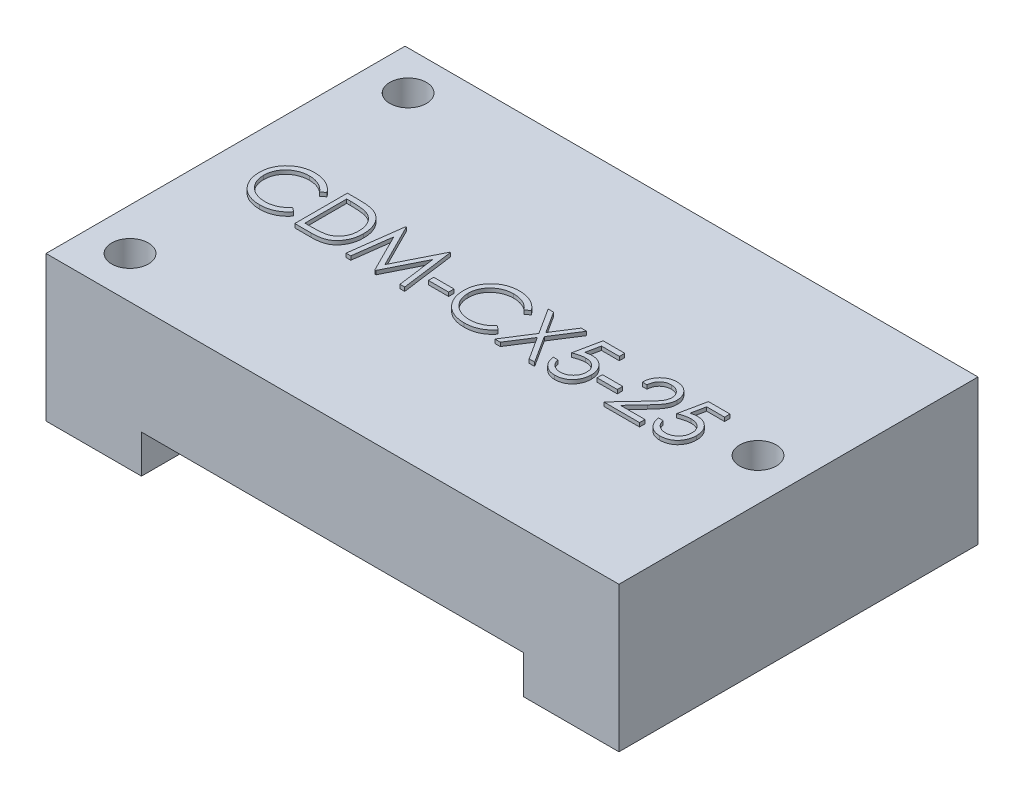
from build123d import *

# Parameters (mm, degrees)
SKETCH1_W               = 38.1
SKETCH1_H               = 23.876
SKETCH1_R               = 1.2192
BOSS_EXTRUDE1_DEPTH     = 9.652
SKETCH2_W               = 1.346153846
SKETCH2_H               = 0.358974359
BOSS_EXTRUDE2_DEPTH     = 0.254
CUT_EXTRUDE1_DEPTH      = 25.465883475
CUT_EXTRUDE1_DEPTH_BACK = 25.465883475
SKETCH4_W               = 25.4
SKETCH4_H               = 2.54


with BuildPart() as part:
    # Sketch1 → Boss-Extrude1 (new body)
    with BuildSketch(Plane(origin=(0, 0, 0), x_dir=(1, 0, 0), z_dir=(0, 1, 0))):
        Rectangle(SKETCH1_W, SKETCH1_H)
        with Locations((-16.256, 9.3472)):
            Circle(SKETCH1_R, mode=Mode.SUBTRACT)
        with Locations((-16.256, -9.144)):
            Circle(SKETCH1_R, mode=Mode.SUBTRACT)
        with Locations((16.256, 0.1016)):
            Circle(SKETCH1_R, mode=Mode.SUBTRACT)
    extrude(amount=-BOSS_EXTRUDE1_DEPTH)

    # Sketch2 → Boss-Extrude2 (add)
    # profile 1 of 10: a face of its own
    with BuildSketch(Plane(origin=(0, 0, 0), x_dir=(1, 0, 0), z_dir=(0, 1, 0))):
        with BuildLine():
            Line((-12.967255042, 0.660782807), (-13.242094786, 0.450446269))
            add(Edge.make_bspline(
                [(-13.242094786, 0.450446269), (-13.261700674, 0.473812239), (-13.300648121, 0.520229154), (-13.363307324, 0.585408699), (-13.428608966, 0.64647396), (-13.496528088, 0.70371584), (-13.568287207, 0.755132606), (-13.642148006, 0.803403708), (-13.719346051, 0.846671446), (-13.826097786, 0.899134433), (-13.965745634, 0.953880588), (-14.141540473, 0.999783819), (-14.325051572, 1.029004995), (-14.450249171, 1.032169836), (-14.513929722, 1.033779602)],
                knots=[0, 0, 0, 0, 0.757959112, 1.505699292, 2.245454638, 2.979532153, 3.711538275, 4.438200793, 5.171680507, 5.909471876, 7.393775596, 8.890124382, 10.418191784, 12, 12, 12, 12], degree=3))
            add(Edge.make_bspline(
                [(-14.513929722, 1.033779602), (-14.549013021, 1.03337564), (-14.618854014, 1.032571464), (-14.722502487, 1.021962338), (-14.824215538, 1.007051128), (-14.923927005, 0.984925805), (-15.021509963, 0.956953186), (-15.117602365, 0.923527772), (-15.210812965, 0.882172932), (-15.302431203, 0.836464672), (-15.390210414, 0.784837228), (-15.473265462, 0.728523876), (-15.55129343, 0.668154779), (-15.624356042, 0.603503673), (-15.69252799, 0.534861712), (-15.755315301, 0.461497371), (-15.812500711, 0.383645197), (-15.865217736, 0.30233179), (-15.91243047, 0.217793998), (-15.951960349, 0.129718928), (-15.986965471, 0.039614825), (-16.014664714, -0.053536336), (-16.036589231, -0.149079102), (-16.051716894, -0.24726989), (-16.062205365, -0.347903569), (-16.063005542, -0.416112882), (-16.063408888, -0.450495238)],
                knots=[0, 0, 0, 0, 1.054917814, 2.100044995, 3.131103042, 4.146048494, 5.169673617, 6.183595914, 7.203665975, 8.234915748, 9.262203917, 10.264457458, 11.251630812, 12.227803204, 13.197192746, 14.159520551, 15.12972552, 16.100847026, 17.073214652, 18.039054194, 19.002613845, 19.979014051, 20.95965708, 21.949030935, 22.966165397, 24, 24, 24, 24], degree=3))
            add(Edge.make_bspline(
                [(-16.063408888, -0.450495238), (-16.062147069, -0.502226558), (-16.059669655, -0.603794142), (-16.037621321, -0.752564753), (-16.00411623, -0.895085427), (-15.953900653, -1.030465269), (-15.891981602, -1.160373627), (-15.813740991, -1.282612481), (-15.723124453, -1.399029045), (-15.618850034, -1.506871993), (-15.504444218, -1.605385718), (-15.381696306, -1.6921363), (-15.250912019, -1.764451182), (-15.113535388, -1.824627129), (-14.968509274, -1.870883856), (-14.816094472, -1.90344798), (-14.656622477, -1.92469016), (-14.547653077, -1.926723848), (-14.492194946, -1.927758859)],
                knots=[0, 0, 0, 0, 1.029171465, 2.020641659, 2.987623507, 3.938342917, 4.889210282, 5.84687017, 6.821220943, 7.821438502, 8.827599549, 9.822697543, 10.807740252, 11.797342354, 12.80366471, 13.83203677, 14.896651826, 16, 16, 16, 16], degree=3))
            add(Edge.make_bspline(
                [(-14.492194946, -1.927758859), (-14.431092257, -1.92607008), (-14.310827548, -1.922746157), (-14.134459522, -1.894586908), (-13.965623756, -1.84892899), (-13.80431117, -1.785031068), (-13.650976523, -1.70196578), (-13.505379863, -1.601267903), (-13.367398293, -1.48197957), (-13.28442701, -1.390896442), (-13.242094786, -1.344425526)],
                knots=[0, 0, 0, 0, 1.028121516, 2.023589091, 2.998037872, 3.967518031, 4.937445131, 5.927275754, 6.942489185, 8, 8, 8, 8], degree=3))
            Line((-13.242094786, -1.344425526), (-12.967255042, -1.552658699))
            add(Edge.make_bspline(
                [(-12.967255042, -1.552658699), (-12.989373152, -1.581197151), (-13.033503427, -1.638137357), (-13.104961444, -1.718409067), (-13.180238742, -1.793913103), (-13.259894452, -1.864040724), (-13.343012243, -1.930195189), (-13.431084556, -1.990497021), (-13.522953588, -2.045787905), (-13.618308067, -2.09641483), (-13.71704668, -2.141332077), (-13.819051115, -2.179785844), (-13.92388169, -2.212910734), (-14.031543199, -2.240162671), (-14.142258956, -2.261433754), (-14.25562943, -2.275653429), (-14.371899305, -2.285395344), (-14.450340726, -2.28628326), (-14.490091581, -2.286733218)],
                knots=[0, 0, 0, 0, 0.986787822, 1.968848986, 2.935600012, 3.899624008, 4.868462664, 5.837806735, 6.815139263, 7.798259679, 8.787526145, 9.778297419, 10.776456485, 11.791383307, 12.812564526, 13.85620153, 14.913611965, 16, 16, 16, 16], degree=3))
            add(Edge.make_bspline(
                [(-14.490091581, -2.286733218), (-14.527735248, -2.286471226), (-14.602170938, -2.285953168), (-14.712069689, -2.277561001), (-14.81905927, -2.266111264), (-14.922833896, -2.248871133), (-15.023959871, -2.228526793), (-15.121520456, -2.201255536), (-15.216475666, -2.170706369), (-15.308444007, -2.134801383), (-15.397503707, -2.0942852), (-15.483367518, -2.048493641), (-15.56599595, -1.997811777), (-15.646201371, -1.943356766), (-15.722798955, -1.883379464), (-15.79645248, -1.81871283), (-15.867574956, -1.749574819), (-15.911577641, -1.699719966), (-15.933701356, -1.674653892)],
                knots=[0, 0, 0, 0, 1.114604814, 2.203992996, 3.262667896, 4.300477797, 5.318619304, 6.316056647, 7.298880507, 8.271930387, 9.238335007, 10.195173496, 11.151986948, 12.108099108, 13.064862484, 14.031167946, 15.010108607, 16, 16, 16, 16], degree=3))
            add(Edge.make_bspline(
                [(-15.933701356, -1.674653892), (-15.969137, -1.631112703), (-16.039580477, -1.544555992), (-16.12970616, -1.404270011), (-16.206853715, -1.257801802), (-16.269229636, -1.104381873), (-16.317992369, -0.944354486), (-16.351773564, -0.777638972), (-16.373725169, -0.604391029), (-16.376235458, -0.486554241), (-16.377511453, -0.426657097)],
                knots=[0, 0, 0, 0, 0.994628077, 1.977248131, 2.950237994, 3.925870899, 4.908910175, 5.911660606, 6.938484602, 8, 8, 8, 8], degree=3))
            add(Edge.make_bspline(
                [(-16.377511453, -0.426657097), (-16.375956259, -0.363701643), (-16.372896513, -0.239840719), (-16.346900717, -0.058066765), (-16.305081921, 0.116084634), (-16.245685032, 0.282288378), (-16.170379681, 0.441418658), (-16.077353067, 0.592259863), (-15.967685925, 0.735776663), (-15.842238357, 0.869791414), (-15.704671022, 0.992330767), (-15.557352208, 1.100136971), (-15.400570261, 1.189854487), (-15.23605241, 1.264850649), (-15.062566728, 1.322495112), (-14.880483359, 1.362848299), (-14.690144444, 1.387965415), (-14.560282018, 1.391140623), (-14.494298311, 1.392753961)],
                knots=[0, 0, 0, 0, 1.032925535, 2.032216505, 3.007276963, 3.968222605, 4.92396291, 5.891752235, 6.871517503, 7.883894988, 8.900124299, 9.891468569, 10.874487609, 11.85992873, 12.854644235, 13.869047385, 14.917252991, 16, 16, 16, 16], degree=3))
            add(Edge.make_bspline(
                [(-14.494298311, 1.392753961), (-14.45408384, 1.392271823), (-14.374483342, 1.391317479), (-14.25673069, 1.382011337), (-14.142088363, 1.366497731), (-14.030477381, 1.345381661), (-13.921354765, 1.319174339), (-13.815554524, 1.285034041), (-13.712455837, 1.24599751), (-13.612708929, 1.201039044), (-13.516792379, 1.150572302), (-13.42473606, 1.095156679), (-13.337271201, 1.034860873), (-13.253782353, 0.970197698), (-13.175666142, 0.899799139), (-13.100704663, 0.825601543), (-13.031443585, 0.745467718), (-12.98869039, 0.689062784), (-12.967255042, 0.660782807)],
                knots=[0, 0, 0, 0, 1.096760587, 2.17092713, 3.219439832, 4.250915756, 5.268269357, 6.278326846, 7.281116186, 8.274029601, 9.260640565, 10.235837813, 11.203064059, 12.156899882, 13.114053108, 14.069676657, 15.032185724, 16, 16, 16, 16], degree=3))
        make_face()
    # profile 2 of 10: a face of its own
    with BuildSketch(Plane(origin=(0, 0, 0), x_dir=(1, 0, 0), z_dir=(0, 1, 0))):
        with BuildLine():
            Line((-12.249306324, -2.196989629), (-12.249306324, 1.303010371))
            Line((-12.249306324, 1.303010371), (-11.542575555, 1.303010371))
            add(Edge.make_bspline(
                [(-11.542575555, 1.303010371), (-11.481106567, 1.302567801), (-11.362348802, 1.301712758), (-11.190736354, 1.296291367), (-11.031952592, 1.286700901), (-10.886519733, 1.272731375), (-10.754038521, 1.255578342), (-10.634879912, 1.234077937), (-10.52842777, 1.208689767), (-10.462958329, 1.187044317), (-10.431998632, 1.176808448)],
                knots=[0, 0, 0, 0, 1.314313732, 2.53924729, 3.670748893, 4.714932338, 5.66265055, 6.526160246, 7.303039223, 8, 8, 8, 8], degree=3))
            add(Edge.make_bspline(
                [(-10.431998632, 1.176808448), (-10.391503893, 1.161377743), (-10.3114327, 1.130866249), (-10.197425578, 1.073309947), (-10.090100215, 1.008096845), (-9.98888107, 0.935140983), (-9.896080244, 0.852376634), (-9.808072347, 0.763319549), (-9.728457623, 0.664731208), (-9.655549327, 0.55865622), (-9.589813668, 0.446344168), (-9.53267451, 0.32800906), (-9.485220516, 0.204251851), (-9.44582729, 0.075416703), (-9.414780832, -0.058779674), (-9.393598901, -0.19849354), (-9.379627911, -0.34317273), (-9.378223859, -0.441347194), (-9.377511453, -0.491160302)],
                knots=[0, 0, 0, 0, 0.984719456, 1.947108742, 2.898477687, 3.838006223, 4.779231079, 5.722358779, 6.681677486, 7.655904652, 8.64651281, 9.637519902, 10.640069247, 11.656948941, 12.698408672, 13.768548281, 14.867775369, 16, 16, 16, 16], degree=3))
            add(Edge.make_bspline(
                [(-9.377511453, -0.491160302), (-9.37814042, -0.53442154), (-9.379379866, -0.619672329), (-9.390509182, -0.745313225), (-9.406685502, -0.867226796), (-9.4317297, -0.984832496), (-9.462132213, -1.099160714), (-9.501096365, -1.208992958), (-9.545731861, -1.315336768), (-9.597781739, -1.416754244), (-9.654923124, -1.512837616), (-9.716244868, -1.603413144), (-9.781681563, -1.687188366), (-9.851857196, -1.764416978), (-9.925864912, -1.834982556), (-10.004189243, -1.899474572), (-10.087032294, -1.956631127), (-10.174023016, -2.008698235), (-10.267699146, -2.05411859), (-10.369835012, -2.0925486), (-10.48086619, -2.124395215), (-10.600520147, -2.150966111), (-10.729003624, -2.172043414), (-10.86644259, -2.186169806), (-11.01262588, -2.195722739), (-11.113005145, -2.196559132), (-11.164670908, -2.196989629)],
                knots=[0, 0, 0, 0, 1.105936401, 2.179363191, 3.223086493, 4.248585256, 5.251745608, 6.245858792, 7.225916811, 8.198733463, 9.158002045, 10.082870192, 10.993790845, 11.873723703, 12.748670949, 13.606408763, 14.465103618, 15.319838547, 16.196477973, 17.123216899, 18.106603292, 19.147568657, 20.255746949, 21.433717677, 22.679120308, 24, 24, 24, 24], degree=3))
            Line((-11.164670908, -2.196989629), (-12.249306324, -2.196989629))
        make_face()
        with BuildLine():
            Line((-11.93520376, -1.83801527), (-11.533460972, -1.83801527))
            add(Edge.make_bspline(
                [(-11.533460972, -1.83801527), (-11.475732601, -1.837767173), (-11.364699803, -1.837289993), (-11.205041805, -1.83310279), (-11.059162409, -1.826260853), (-10.927040899, -1.816685775), (-10.808751875, -1.80401716), (-10.704048125, -1.789892257), (-10.613272867, -1.772294806), (-10.55834343, -1.756343847), (-10.53296017, -1.748972802)],
                knots=[0, 0, 0, 0, 1.375205317, 2.645023457, 3.804390687, 4.853969522, 5.800190428, 6.637939096, 7.370582563, 8, 8, 8, 8], degree=3))
            add(Edge.make_bspline(
                [(-10.53296017, -1.748972802), (-10.501011808, -1.737721244), (-10.43787817, -1.71548687), (-10.346997085, -1.674929209), (-10.26224008, -1.626887139), (-10.182130055, -1.573484865), (-10.1078034, -1.512838863), (-10.038379283, -1.446267875), (-9.973997482, -1.373433099), (-9.915323174, -1.294424938), (-9.86281487, -1.209735142), (-9.817343641, -1.120196309), (-9.777492109, -1.026789498), (-9.746213516, -0.92808034), (-9.721697932, -0.824951281), (-9.704333244, -0.717395068), (-9.69351852, -0.605431786), (-9.692257072, -0.529279662), (-9.691614017, -0.49045918)],
                knots=[0, 0, 0, 0, 0.998632004, 1.973411704, 2.929992603, 3.868527914, 4.809262121, 5.754881198, 6.702106254, 7.672490631, 8.653608572, 9.636854334, 10.631411391, 11.644891563, 12.686317036, 13.754757253, 14.855430412, 16, 16, 16, 16], degree=3))
            add(Edge.make_bspline(
                [(-9.691614017, -0.49045918), (-9.692127304, -0.4495257), (-9.693135662, -0.369111515), (-9.705809972, -0.25112082), (-9.724331527, -0.13764017), (-9.751115214, -0.028661974), (-9.785246092, 0.076026378), (-9.827840734, 0.175845888), (-9.876507353, 0.271850757), (-9.93441069, 0.361825123), (-9.997826284, 0.446918232), (-10.068204163, 0.524873148), (-10.144426201, 0.595867448), (-10.225661051, 0.661006761), (-10.31419815, 0.717670436), (-10.407951841, 0.768357117), (-10.508297512, 0.811373009), (-10.578110208, 0.834251872), (-10.613589177, 0.845878961)],
                knots=[0, 0, 0, 0, 1.122418816, 2.205001699, 3.251619955, 4.274784885, 5.280384055, 6.268708349, 7.249350384, 8.229342522, 9.199999885, 10.157847722, 11.105861043, 12.055065948, 13.010012805, 13.98527497, 14.976112212, 16, 16, 16, 16], degree=3))
            add(Edge.make_bspline(
                [(-10.613589177, 0.845878961), (-10.642940323, 0.853995389), (-10.705348914, 0.871253141), (-10.807188378, 0.890078514), (-10.921803527, 0.906683013), (-11.049703228, 0.920741052), (-11.190741687, 0.930828374), (-11.345027375, 0.938399688), (-11.51262698, 0.943506321), (-11.628809514, 0.943855028), (-11.68911001, 0.944036012)],
                knots=[0, 0, 0, 0, 0.674548936, 1.434276114, 2.292660221, 3.240891867, 4.284742987, 5.42552168, 6.663806718, 8, 8, 8, 8], degree=3))
            Line((-11.68911001, 0.944036012), (-11.93520376, 0.944036012))
            Line((-11.93520376, 0.944036012), (-11.93520376, -1.83801527))
        make_face(mode=Mode.SUBTRACT)
    # profile 3 of 10: a face of its own
    with BuildSketch(Plane(origin=(0, 0, 0), x_dir=(1, 0, 0), z_dir=(0, 1, 0))):
        Polygon((-8.839049914, -2.196989629), (-8.377010651, 1.303010371), (-8.332138856, 1.303010371), (-6.887126837, -1.5687845), (-5.445620427, 1.303010371), (-5.40004751, 1.303010371), (-4.93520376, -2.196989629), (-5.250708568, -2.196989629), (-5.585844786, 0.321439858), (-6.84926626, -2.196989629), (-6.920079561, -2.196989629), (-8.188408888, 0.327048833), (-8.522843985, -2.196989629), align=None)
    # profile 4 of 10: a face of its own
    with BuildSketch(Plane(origin=(0, 0, 0), x_dir=(1, 0, 0), z_dir=(0, 1, 0))):
        with Locations((-3.858280683, -0.850835783)):
            Rectangle(SKETCH2_W, SKETCH2_H)
    # profile 5 of 10: a face of its own
    with BuildSketch(Plane(origin=(0, 0, 0), x_dir=(1, 0, 0), z_dir=(0, 1, 0))):
        with BuildLine():
            Line((0.628898804, 0.660782807), (0.35405906, 0.450446269))
            add(Edge.make_bspline(
                [(0.35405906, 0.450446269), (0.334453172, 0.473812239), (0.295505725, 0.520229154), (0.232846523, 0.585408699), (0.16754488, 0.64647396), (0.099625758, 0.70371584), (0.027866639, 0.755132606), (-0.04599416, 0.803403708), (-0.123192205, 0.846671446), (-0.22994394, 0.899134433), (-0.369591788, 0.953880588), (-0.545386627, 0.999783819), (-0.728897725, 1.029004995), (-0.854095325, 1.032169836), (-0.917775876, 1.033779602)],
                knots=[0, 0, 0, 0, 0.757959112, 1.505699292, 2.245454638, 2.979532153, 3.711538275, 4.438200793, 5.171680507, 5.909471876, 7.393775596, 8.890124382, 10.418191784, 12, 12, 12, 12], degree=3))
            add(Edge.make_bspline(
                [(-0.917775876, 1.033779602), (-0.952859175, 1.03337564), (-1.022700168, 1.032571464), (-1.126348641, 1.021962338), (-1.228061692, 1.007051128), (-1.327773158, 0.984925805), (-1.425356117, 0.956953186), (-1.521448519, 0.923527772), (-1.614659119, 0.882172932), (-1.706277357, 0.836464672), (-1.794056568, 0.784837228), (-1.877111616, 0.728523876), (-1.955139584, 0.668154779), (-2.028202196, 0.603503673), (-2.096374144, 0.534861712), (-2.159161455, 0.461497371), (-2.216346865, 0.383645197), (-2.26906389, 0.30233179), (-2.316276624, 0.217793998), (-2.355806503, 0.129718928), (-2.390811625, 0.039614825), (-2.418510868, -0.053536336), (-2.440435385, -0.149079102), (-2.455563048, -0.24726989), (-2.466051519, -0.347903569), (-2.466851696, -0.416112882), (-2.467255042, -0.450495238)],
                knots=[0, 0, 0, 0, 1.054917814, 2.100044995, 3.131103042, 4.146048494, 5.169673617, 6.183595914, 7.203665975, 8.234915748, 9.262203917, 10.264457458, 11.251630812, 12.227803204, 13.197192746, 14.159520551, 15.12972552, 16.100847026, 17.073214652, 18.039054194, 19.002613845, 19.979014051, 20.95965708, 21.949030935, 22.966165397, 24, 24, 24, 24], degree=3))
            add(Edge.make_bspline(
                [(-2.467255042, -0.450495238), (-2.465993223, -0.502226558), (-2.463515809, -0.603794142), (-2.441467475, -0.752564753), (-2.407962384, -0.895085427), (-2.357746807, -1.030465269), (-2.295827756, -1.160373627), (-2.217587145, -1.282612481), (-2.126970607, -1.399029045), (-2.022696188, -1.506871993), (-1.908290372, -1.605385718), (-1.78554246, -1.6921363), (-1.654758172, -1.764451182), (-1.517381542, -1.824627129), (-1.372355428, -1.870883856), (-1.219940626, -1.90344798), (-1.060468631, -1.92469016), (-0.951499231, -1.926723848), (-0.8960411, -1.927758859)],
                knots=[0, 0, 0, 0, 1.029171465, 2.020641659, 2.987623507, 3.938342917, 4.889210282, 5.84687017, 6.821220943, 7.821438502, 8.827599549, 9.822697543, 10.807740252, 11.797342354, 12.80366471, 13.83203677, 14.896651826, 16, 16, 16, 16], degree=3))
            add(Edge.make_bspline(
                [(-0.8960411, -1.927758859), (-0.834938411, -1.92607008), (-0.714673702, -1.922746157), (-0.538305676, -1.894586908), (-0.36946991, -1.84892899), (-0.208157324, -1.785031068), (-0.054822677, -1.70196578), (0.090773983, -1.601267903), (0.228755553, -1.48197957), (0.311726836, -1.390896442), (0.35405906, -1.344425526)],
                knots=[0, 0, 0, 0, 1.028121516, 2.023589091, 2.998037872, 3.967518031, 4.937445131, 5.927275754, 6.942489185, 8, 8, 8, 8], degree=3))
            Line((0.35405906, -1.344425526), (0.628898804, -1.552658699))
            add(Edge.make_bspline(
                [(0.628898804, -1.552658699), (0.606780694, -1.581197151), (0.562650419, -1.638137357), (0.491192402, -1.718409067), (0.415915104, -1.793913103), (0.336259394, -1.864040724), (0.253141603, -1.930195189), (0.16506929, -1.990497021), (0.073200258, -2.045787905), (-0.022154221, -2.09641483), (-0.120892834, -2.141332077), (-0.222897269, -2.179785844), (-0.327727844, -2.212910734), (-0.435389353, -2.240162671), (-0.546105109, -2.261433754), (-0.659475584, -2.275653429), (-0.775745459, -2.285395344), (-0.85418688, -2.28628326), (-0.893937735, -2.286733218)],
                knots=[0, 0, 0, 0, 0.986787822, 1.968848986, 2.935600012, 3.899624008, 4.868462664, 5.837806735, 6.815139263, 7.798259679, 8.787526145, 9.778297419, 10.776456485, 11.791383307, 12.812564526, 13.85620153, 14.913611965, 16, 16, 16, 16], degree=3))
            add(Edge.make_bspline(
                [(-0.893937735, -2.286733218), (-0.931581402, -2.286471226), (-1.006017092, -2.285953168), (-1.115915843, -2.277561001), (-1.222905424, -2.266111264), (-1.32668005, -2.248871133), (-1.427806025, -2.228526793), (-1.52536661, -2.201255536), (-1.62032182, -2.170706369), (-1.712290161, -2.134801383), (-1.80134986, -2.0942852), (-1.887213672, -2.048493641), (-1.969842104, -1.997811777), (-2.050047525, -1.943356766), (-2.126645109, -1.883379464), (-2.200298634, -1.81871283), (-2.27142111, -1.749574819), (-2.315423795, -1.699719966), (-2.33754751, -1.674653892)],
                knots=[0, 0, 0, 0, 1.114604814, 2.203992996, 3.262667896, 4.300477797, 5.318619304, 6.316056647, 7.298880507, 8.271930387, 9.238335007, 10.195173496, 11.151986948, 12.108099108, 13.064862484, 14.031167946, 15.010108607, 16, 16, 16, 16], degree=3))
            add(Edge.make_bspline(
                [(-2.33754751, -1.674653892), (-2.372983154, -1.631112703), (-2.443426631, -1.544555992), (-2.533552314, -1.404270011), (-2.610699869, -1.257801802), (-2.67307579, -1.104381873), (-2.721838523, -0.944354486), (-2.755619718, -0.777638972), (-2.777571323, -0.604391029), (-2.780081612, -0.486554241), (-2.781357606, -0.426657097)],
                knots=[0, 0, 0, 0, 0.994628077, 1.977248131, 2.950237994, 3.925870899, 4.908910175, 5.911660606, 6.938484602, 8, 8, 8, 8], degree=3))
            add(Edge.make_bspline(
                [(-2.781357606, -0.426657097), (-2.779802413, -0.363701643), (-2.776742667, -0.239840719), (-2.750746871, -0.058066765), (-2.708928075, 0.116084634), (-2.649531186, 0.282288378), (-2.574225835, 0.441418658), (-2.481199221, 0.592259863), (-2.371532079, 0.735776663), (-2.246084511, 0.869791414), (-2.108517176, 0.992330767), (-1.961198362, 1.100136971), (-1.804416415, 1.189854487), (-1.639898563, 1.264850649), (-1.466412882, 1.322495112), (-1.284329513, 1.362848299), (-1.093990598, 1.387965415), (-0.964128172, 1.391140623), (-0.898144465, 1.392753961)],
                knots=[0, 0, 0, 0, 1.032925535, 2.032216505, 3.007276963, 3.968222605, 4.92396291, 5.891752235, 6.871517503, 7.883894988, 8.900124299, 9.891468569, 10.874487609, 11.85992873, 12.854644235, 13.869047385, 14.917252991, 16, 16, 16, 16], degree=3))
            add(Edge.make_bspline(
                [(-0.898144465, 1.392753961), (-0.857929993, 1.392271823), (-0.778329496, 1.391317479), (-0.660576844, 1.382011337), (-0.545934517, 1.366497731), (-0.434323535, 1.345381661), (-0.325200918, 1.319174339), (-0.219400678, 1.285034041), (-0.116301991, 1.24599751), (-0.016555083, 1.201039044), (0.079361468, 1.150572302), (0.171417786, 1.095156679), (0.258882645, 1.034860873), (0.342371493, 0.970197698), (0.420487704, 0.899799139), (0.495449183, 0.825601543), (0.564710261, 0.745467718), (0.607463456, 0.689062784), (0.628898804, 0.660782807)],
                knots=[0, 0, 0, 0, 1.096760587, 2.17092713, 3.219439832, 4.250915756, 5.268269357, 6.278326846, 7.281116186, 8.274029601, 9.260640565, 10.235837813, 11.203064059, 12.156899882, 13.114053108, 14.069676657, 15.032185724, 16, 16, 16, 16], degree=3))
        make_face()
    # profile 6 of 10: a face of its own
    with BuildSketch(Plane(origin=(0, 0, 0), x_dir=(1, 0, 0), z_dir=(0, 1, 0))):
        Polygon((1.10005265, 1.303010371), (1.462532618, 1.303010371), (2.378898804, -0.128680334), (3.29526499, 1.303010371), (3.657744958, 1.303010371), (2.560489349, -0.411933539), (3.702616753, -2.196989629), (3.340136785, -2.196989629), (2.378898804, -0.695186744), (1.417660823, -2.196989629), (1.055180855, -2.196989629), (2.198009381, -0.411933539), align=None)
    # profile 7 of 10: a face of its own
    with BuildSketch(Plane(origin=(0, 0, 0), x_dir=(1, 0, 0), z_dir=(0, 1, 0))):
        with BuildLine():
            Line((6.193001368, 1.303010371), (6.193001368, 0.944036012))
            Line((6.193001368, 0.944036012), (5.00249656, 0.944036012))
            Line((5.00249656, 0.944036012), (4.813894797, 0.023463096))
            add(Edge.make_bspline(
                [(4.813894797, 0.023463096), (4.850950672, 0.033693367), (4.922740568, 0.053512901), (5.028700429, 0.075518672), (5.129292632, 0.088784116), (5.194568003, 0.090595426), (5.226154413, 0.09147191)],
                knots=[0, 0, 0, 0, 1.100273476, 2.13160584, 3.095893838, 4, 4, 4, 4], degree=3))
            add(Edge.make_bspline(
                [(5.226154413, 0.09147191), (5.265238153, 0.090625974), (5.34208655, 0.088962653), (5.454525497, 0.072990804), (5.56185839, 0.047850889), (5.66386076, 0.012730367), (5.760721311, -0.032179366), (5.851548872, -0.088279306), (5.937706785, -0.153812637), (6.017649379, -0.229157649), (6.090173688, -0.312079266), (6.153939677, -0.401237137), (6.208102267, -0.495764799), (6.251663022, -0.596565408), (6.286447357, -0.702524561), (6.309599351, -0.814757144), (6.32501606, -0.932205264), (6.326738447, -1.012509834), (6.327616753, -1.053459981)],
                knots=[0, 0, 0, 0, 1.052922333, 2.070308379, 3.05430497, 4.020497103, 4.973039431, 5.925935799, 6.892292201, 7.88610001, 8.88166317, 9.857072816, 10.836096531, 11.812156883, 12.81219415, 13.836441305, 14.89672472, 16, 16, 16, 16], degree=3))
            add(Edge.make_bspline(
                [(6.327616753, -1.053459981), (6.326951677, -1.081982202), (6.325630515, -1.138641189), (6.318911927, -1.22278539), (6.305976211, -1.305148223), (6.288608487, -1.385740615), (6.266066069, -1.464409987), (6.238777015, -1.541381515), (6.205380988, -1.616176122), (6.168749612, -1.689501517), (6.127503134, -1.759700024), (6.081724627, -1.82534901), (6.033359136, -1.887433292), (5.98131775, -1.945287025), (5.925116755, -1.998530043), (5.865436788, -2.047478324), (5.802754069, -2.092959655), (5.736098827, -2.13312785), (5.666956344, -2.170090806), (5.594328127, -2.200414343), (5.519867426, -2.227524871), (5.442502551, -2.249134399), (5.362408738, -2.266066953), (5.279453963, -2.277567554), (5.194073293, -2.285943992), (5.13619828, -2.286468348), (5.106963708, -2.286733218)],
                knots=[0, 0, 0, 0, 1.056347294, 2.098418968, 3.122841568, 4.141288669, 5.149314143, 6.15115421, 7.162517403, 8.180376062, 9.185164535, 10.17417709, 11.141909838, 12.097768115, 13.052685741, 14.0056014, 14.954263652, 15.917497458, 16.885230207, 17.854509472, 18.828990115, 19.81800267, 20.826176721, 21.857883937, 22.917946725, 24, 24, 24, 24], degree=3))
            add(Edge.make_bspline(
                [(5.106963708, -2.286733218), (5.072089527, -2.28604238), (5.003478696, -2.284683238), (4.902958129, -2.270464753), (4.806243524, -2.250100837), (4.714113422, -2.219464567), (4.625742159, -2.181077272), (4.542319441, -2.132561101), (4.461713665, -2.077581997), (4.387201628, -2.012701644), (4.318045515, -1.941785962), (4.256139006, -1.864828321), (4.201005429, -1.783098879), (4.153527682, -1.696200725), (4.113029661, -1.604362194), (4.081214672, -1.507239193), (4.055536318, -1.405339189), (4.044672897, -1.335185678), (4.039155214, -1.299553731)],
                knots=[0, 0, 0, 0, 1.0467383, 2.05933395, 3.04377827, 4.011590433, 4.970194871, 5.932262533, 6.905835911, 7.896367577, 8.894135286, 9.877477877, 10.858688626, 11.851381753, 12.8477658, 13.868841284, 14.917554742, 16, 16, 16, 16], degree=3))
            Line((4.039155214, -1.299553731), (4.353257778, -1.299553731))
            add(Edge.make_bspline(
                [(4.353257778, -1.299553731), (4.360986336, -1.332930184), (4.375841052, -1.397081579), (4.408446801, -1.48721292), (4.448312676, -1.567532144), (4.495717025, -1.639101727), (4.552267055, -1.701510724), (4.616796484, -1.757127786), (4.689144207, -1.807302915), (4.769537437, -1.849125683), (4.854350516, -1.884794436), (4.943117726, -1.908546131), (5.033422073, -1.925247024), (5.094500443, -1.926918785), (5.125192874, -1.927758859)],
                knots=[0, 0, 0, 0, 1.136247022, 2.183929868, 3.172523383, 4.106158343, 5.02341133, 5.958108904, 6.928429099, 7.938127109, 8.96079061, 9.975095812, 10.982467395, 12, 12, 12, 12], degree=3))
            add(Edge.make_bspline(
                [(5.125192874, -1.927758859), (5.155151319, -1.926938082), (5.214139741, -1.925321963), (5.300951128, -1.912882951), (5.384764002, -1.89372538), (5.464751359, -1.865055525), (5.542312898, -1.830210806), (5.615486669, -1.785495731), (5.686389546, -1.734035712), (5.752817679, -1.675079082), (5.813657129, -1.610109387), (5.86741325, -1.540631994), (5.912190163, -1.466515147), (5.949924272, -1.389041995), (5.978577571, -1.307363437), (5.999018552, -1.221862262), (6.011021611, -1.132327282), (6.012672791, -1.071257972), (6.013514189, -1.040138667)],
                knots=[0, 0, 0, 0, 1.027316725, 2.022795036, 3.002884548, 3.971462791, 4.93288096, 5.914575861, 6.907176829, 7.935150275, 8.956128384, 9.956726525, 10.942570165, 11.921478529, 12.907843606, 13.90538589, 14.932640048, 16, 16, 16, 16], degree=3))
            add(Edge.make_bspline(
                [(6.013514189, -1.040138667), (6.012855709, -1.012062916), (6.011566829, -0.957108626), (6.001036259, -0.87670942), (5.982719287, -0.800636378), (5.957295407, -0.728522144), (5.925015899, -0.660298701), (5.885569587, -0.595895641), (5.838216189, -0.536161808), (5.7841243, -0.481069254), (5.724866259, -0.43022438), (5.659422516, -0.386880293), (5.58916259, -0.350416375), (5.51493299, -0.318948377), (5.434968092, -0.296347632), (5.350851459, -0.279379746), (5.261674751, -0.269564384), (5.200704063, -0.268202495), (5.169363547, -0.267502449)],
                knots=[0, 0, 0, 0, 1.045622112, 2.046656509, 3.013763289, 3.955457236, 4.890082067, 5.820317437, 6.762574623, 7.722996705, 8.69280354, 9.665887285, 10.63943826, 11.638615906, 12.663482002, 13.728887084, 14.832589034, 16, 16, 16, 16], degree=3))
            add(Edge.make_bspline(
                [(5.169363547, -0.267502449), (5.142234619, -0.26808304), (5.086220263, -0.269281814), (5.000297437, -0.278108311), (4.910005714, -0.292347605), (4.815691218, -0.311933853), (4.71707071, -0.337564929), (4.614352309, -0.36827943), (4.507320043, -0.405001429), (4.435202318, -0.432733642), (4.398129573, -0.446989629)],
                knots=[0, 0, 0, 0, 0.817624296, 1.688186739, 2.600797293, 3.572016777, 4.590301741, 5.671205678, 6.80286297, 8, 8, 8, 8], degree=3))
            Line((4.398129573, -0.446989629), (4.757103932, 1.303010371))
            Line((4.757103932, 1.303010371), (6.193001368, 1.303010371))
        make_face()
    # profile 8 of 10: a face of its own
    with BuildSketch(Plane(origin=(0, 0, 0), x_dir=(1, 0, 0), z_dir=(0, 1, 0))):
        with Locations((7.359668035, -0.850835783)):
            Rectangle(SKETCH2_W, SKETCH2_H)
    # profile 9 of 10: a face of its own
    with BuildSketch(Plane(origin=(0, 0, 0), x_dir=(1, 0, 0), z_dir=(0, 1, 0))):
        with BuildLine():
            Line((8.750693676, 0.226087294), (8.436591112, 0.226087294))
            add(Edge.make_bspline(
                [(8.436591112, 0.226087294), (8.438638265, 0.267758182), (8.442658819, 0.349598697), (8.461487108, 0.468922603), (8.488427985, 0.582977402), (8.526519439, 0.690847316), (8.573825717, 0.793486123), (8.630555744, 0.890486139), (8.697749595, 0.981477327), (8.773956329, 1.065616171), (8.856724968, 1.142803742), (8.946030907, 1.209458984), (9.039875935, 1.265776656), (9.137975334, 1.312857898), (9.241435897, 1.348197743), (9.349318755, 1.374419383), (9.462097891, 1.390195729), (9.538937913, 1.391891514), (9.578017394, 1.392753961)],
                knots=[0, 0, 0, 0, 1.10065271, 2.161652631, 3.183658789, 4.190468796, 5.17591951, 6.163126047, 7.15150782, 8.156236427, 9.156009102, 10.134482811, 11.092018607, 12.041330605, 13.001268258, 13.972401359, 14.968799086, 16, 16, 16, 16], degree=3))
            add(Edge.make_bspline(
                [(9.578017394, 1.392753961), (9.616395468, 1.391855505), (9.691807012, 1.39009007), (9.801869027, 1.374929041), (9.906646321, 1.351183449), (10.005934088, 1.317868033), (10.098940152, 1.273083605), (10.186363197, 1.219286067), (10.269244008, 1.157066235), (10.343850791, 1.083812422), (10.412358871, 1.005610037), (10.471461126, 0.922122134), (10.522074289, 0.835892848), (10.564261969, 0.746264646), (10.595318108, 0.652393618), (10.618896316, 0.555646415), (10.63222373, 0.455021604), (10.634269153, 0.386915048), (10.63530906, 0.352289217)],
                knots=[0, 0, 0, 0, 1.111607364, 2.184268762, 3.212621178, 4.221274766, 5.211760367, 6.196651075, 7.1921475, 8.207485113, 9.220403448, 10.201281604, 11.166441695, 12.114753415, 13.065576456, 14.026450734, 14.996634279, 16, 16, 16, 16], degree=3))
            add(Edge.make_bspline(
                [(10.63530906, 0.352289217), (10.633615797, 0.303541383), (10.630258986, 0.206901169), (10.60154461, 0.064886306), (10.556698098, -0.072707113), (10.502700742, -0.183444415), (10.448228298, -0.272677908), (10.39914079, -0.346146613), (10.341675979, -0.425252082), (10.274997481, -0.509729419), (10.200484609, -0.600240324), (10.117462445, -0.69673012), (10.025338963, -0.798201889), (9.960680463, -0.867507491), (9.927176047, -0.903419917)],
                knots=[0, 0, 0, 0, 1.184426356, 2.348067706, 3.509069118, 4.696110526, 5.333549288, 6.050745305, 6.844228056, 7.710549037, 8.667450064, 9.695053472, 10.805634456, 12, 12, 12, 12], degree=3))
            Line((9.927176047, -0.903419917), (9.051474926, -1.83801527))
            Line((9.051474926, -1.83801527), (10.680180855, -1.83801527))
            Line((10.680180855, -1.83801527), (10.680180855, -2.196989629))
            Line((10.680180855, -2.196989629), (8.301975727, -2.196989629))
            Line((8.301975727, -2.196989629), (9.659347522, -0.748472))
            add(Edge.make_bspline(
                [(9.659347522, -0.748472), (9.692395409, -0.713973694), (9.755873636, -0.647709507), (9.845656213, -0.550966547), (9.926295201, -0.461217006), (9.998312594, -0.378630458), (10.060146099, -0.30199889), (10.115018331, -0.233804187), (10.158983922, -0.171049736), (10.206699318, -0.098309122), (10.252913299, -0.009496805), (10.292625655, 0.099036884), (10.316840504, 0.210764137), (10.319745339, 0.286266174), (10.321206496, 0.324244346)],
                knots=[0, 0, 0, 0, 1.329631726, 2.553950428, 3.673215718, 4.687767853, 5.603093632, 6.413772471, 7.123043292, 7.734684054, 8.834405432, 9.900288307, 10.943827018, 12, 12, 12, 12], degree=3))
            add(Edge.make_bspline(
                [(10.321206496, 0.324244346), (10.320570754, 0.348125744), (10.319317828, 0.395191394), (10.30826013, 0.464197153), (10.291549624, 0.530761967), (10.267604366, 0.595090586), (10.235997626, 0.656536238), (10.197524246, 0.715173719), (10.153134183, 0.771862684), (10.101782914, 0.825015982), (10.045371394, 0.873697187), (9.985777144, 0.916821273), (9.92272704, 0.952860384), (9.856486918, 0.982403881), (9.787241448, 1.005579262), (9.714856703, 1.021637841), (9.639532687, 1.031720325), (9.588099191, 1.033084497), (9.561891592, 1.033779602)],
                knots=[0, 0, 0, 0, 0.991446411, 1.95395049, 2.89581595, 3.838931463, 4.798493298, 5.75982156, 6.748411868, 7.785213223, 8.824556874, 9.840280684, 10.836137867, 11.835679398, 12.848801643, 13.863922112, 14.911575587, 16, 16, 16, 16], degree=3))
            add(Edge.make_bspline(
                [(9.561891592, 1.033779602), (9.53452076, 1.03306457), (9.480768963, 1.031660365), (9.40184993, 1.021837701), (9.326564153, 1.00489186), (9.25472225, 0.981715186), (9.186202664, 0.952256637), (9.12133862, 0.915564892), (9.060275731, 0.871781399), (9.002899208, 0.822140843), (8.950035228, 0.766873242), (8.903588353, 0.705263278), (8.863004338, 0.638435863), (8.827595105, 0.566571313), (8.798839415, 0.489017533), (8.776866264, 0.406049828), (8.759479418, 0.318028446), (8.753670897, 0.257243361), (8.750693676, 0.226087294)],
                knots=[0, 0, 0, 0, 1.031018746, 2.02475058, 2.990194455, 3.934040569, 4.864654155, 5.795059489, 6.735614925, 7.690564532, 8.649604399, 9.611025574, 10.590972636, 11.591080095, 12.624614302, 13.701020113, 14.821632451, 16, 16, 16, 16], degree=3))
        make_face()
    # profile 10 of 10: a face of its own
    with BuildSketch(Plane(origin=(0, 0, 0), x_dir=(1, 0, 0), z_dir=(0, 1, 0))):
        with BuildLine():
            Line((13.193001368, 1.303010371), (13.193001368, 0.944036012))
            Line((13.193001368, 0.944036012), (12.00249656, 0.944036012))
            Line((12.00249656, 0.944036012), (11.813894797, 0.023463096))
            add(Edge.make_bspline(
                [(11.813894797, 0.023463096), (11.850950672, 0.033693367), (11.922740568, 0.053512901), (12.028700429, 0.075518672), (12.129292632, 0.088784116), (12.194568003, 0.090595426), (12.226154413, 0.09147191)],
                knots=[0, 0, 0, 0, 1.100273476, 2.13160584, 3.095893838, 4, 4, 4, 4], degree=3))
            add(Edge.make_bspline(
                [(12.226154413, 0.09147191), (12.265238153, 0.090625974), (12.34208655, 0.088962653), (12.454525497, 0.072990804), (12.56185839, 0.047850889), (12.66386076, 0.012730367), (12.760721311, -0.032179366), (12.851548872, -0.088279306), (12.937706785, -0.153812637), (13.017649379, -0.229157649), (13.090173688, -0.312079266), (13.153939677, -0.401237137), (13.208102267, -0.495764799), (13.251663022, -0.596565408), (13.286447357, -0.702524561), (13.309599351, -0.814757144), (13.32501606, -0.932205264), (13.326738447, -1.012509834), (13.327616753, -1.053459981)],
                knots=[0, 0, 0, 0, 1.052922333, 2.070308379, 3.05430497, 4.020497103, 4.973039431, 5.925935799, 6.892292201, 7.88610001, 8.88166317, 9.857072816, 10.836096531, 11.812156883, 12.81219415, 13.836441305, 14.89672472, 16, 16, 16, 16], degree=3))
            add(Edge.make_bspline(
                [(13.327616753, -1.053459981), (13.326951677, -1.081982202), (13.325630515, -1.138641189), (13.318911927, -1.22278539), (13.305976211, -1.305148223), (13.288608487, -1.385740615), (13.266066069, -1.464409987), (13.238777015, -1.541381515), (13.205380988, -1.616176122), (13.168749612, -1.689501517), (13.127503134, -1.759700024), (13.081724627, -1.82534901), (13.033359136, -1.887433292), (12.98131775, -1.945287025), (12.925116755, -1.998530043), (12.865436788, -2.047478324), (12.802754069, -2.092959655), (12.736098827, -2.13312785), (12.666956344, -2.170090806), (12.594328127, -2.200414343), (12.519867426, -2.227524871), (12.442502551, -2.249134399), (12.362408738, -2.266066953), (12.279453963, -2.277567554), (12.194073293, -2.285943992), (12.13619828, -2.286468348), (12.106963708, -2.286733218)],
                knots=[0, 0, 0, 0, 1.056347294, 2.098418968, 3.122841568, 4.141288669, 5.149314143, 6.15115421, 7.162517403, 8.180376062, 9.185164535, 10.17417709, 11.141909838, 12.097768115, 13.052685741, 14.0056014, 14.954263652, 15.917497458, 16.885230207, 17.854509472, 18.828990115, 19.81800267, 20.826176721, 21.857883937, 22.917946725, 24, 24, 24, 24], degree=3))
            add(Edge.make_bspline(
                [(12.106963708, -2.286733218), (12.072089527, -2.28604238), (12.003478696, -2.284683238), (11.902958129, -2.270464753), (11.806243524, -2.250100837), (11.714113422, -2.219464567), (11.625742159, -2.181077272), (11.542319441, -2.132561101), (11.461713665, -2.077581997), (11.387201628, -2.012701644), (11.318045515, -1.941785962), (11.256139006, -1.864828321), (11.201005429, -1.783098879), (11.153527682, -1.696200725), (11.113029661, -1.604362194), (11.081214672, -1.507239193), (11.055536318, -1.405339189), (11.044672897, -1.335185678), (11.039155214, -1.299553731)],
                knots=[0, 0, 0, 0, 1.0467383, 2.05933395, 3.04377827, 4.011590433, 4.970194871, 5.932262533, 6.905835911, 7.896367577, 8.894135286, 9.877477877, 10.858688626, 11.851381753, 12.8477658, 13.868841284, 14.917554742, 16, 16, 16, 16], degree=3))
            Line((11.039155214, -1.299553731), (11.353257778, -1.299553731))
            add(Edge.make_bspline(
                [(11.353257778, -1.299553731), (11.360986336, -1.332930184), (11.375841052, -1.397081579), (11.408446801, -1.48721292), (11.448312676, -1.567532144), (11.495717025, -1.639101727), (11.552267055, -1.701510724), (11.616796484, -1.757127786), (11.689144207, -1.807302915), (11.769537437, -1.849125683), (11.854350516, -1.884794436), (11.943117726, -1.908546131), (12.033422073, -1.925247024), (12.094500443, -1.926918785), (12.125192874, -1.927758859)],
                knots=[0, 0, 0, 0, 1.136247022, 2.183929868, 3.172523383, 4.106158343, 5.02341133, 5.958108904, 6.928429099, 7.938127109, 8.96079061, 9.975095812, 10.982467395, 12, 12, 12, 12], degree=3))
            add(Edge.make_bspline(
                [(12.125192874, -1.927758859), (12.155151319, -1.926938082), (12.214139741, -1.925321963), (12.300951128, -1.912882951), (12.384764002, -1.89372538), (12.464751359, -1.865055525), (12.542312898, -1.830210806), (12.615486669, -1.785495731), (12.686389546, -1.734035712), (12.752817679, -1.675079082), (12.813657129, -1.610109387), (12.86741325, -1.540631994), (12.912190163, -1.466515147), (12.949924272, -1.389041995), (12.978577571, -1.307363437), (12.999018552, -1.221862262), (13.011021611, -1.132327282), (13.012672791, -1.071257972), (13.013514189, -1.040138667)],
                knots=[0, 0, 0, 0, 1.027316725, 2.022795036, 3.002884548, 3.971462791, 4.93288096, 5.914575861, 6.907176829, 7.935150275, 8.956128384, 9.956726525, 10.942570165, 11.921478529, 12.907843606, 13.90538589, 14.932640048, 16, 16, 16, 16], degree=3))
            add(Edge.make_bspline(
                [(13.013514189, -1.040138667), (13.012855709, -1.012062916), (13.011566829, -0.957108626), (13.001036259, -0.87670942), (12.982719287, -0.800636378), (12.957295407, -0.728522144), (12.925015899, -0.660298701), (12.885569587, -0.595895641), (12.838216189, -0.536161808), (12.7841243, -0.481069254), (12.724866259, -0.43022438), (12.659422516, -0.386880293), (12.58916259, -0.350416375), (12.51493299, -0.318948377), (12.434968092, -0.296347632), (12.350851459, -0.279379746), (12.261674751, -0.269564384), (12.200704063, -0.268202495), (12.169363547, -0.267502449)],
                knots=[0, 0, 0, 0, 1.045622112, 2.046656509, 3.013763289, 3.955457236, 4.890082067, 5.820317437, 6.762574623, 7.722996705, 8.69280354, 9.665887285, 10.63943826, 11.638615906, 12.663482002, 13.728887084, 14.832589034, 16, 16, 16, 16], degree=3))
            add(Edge.make_bspline(
                [(12.169363547, -0.267502449), (12.142234619, -0.26808304), (12.086220263, -0.269281814), (12.000297437, -0.278108311), (11.910005714, -0.292347605), (11.815691218, -0.311933853), (11.71707071, -0.337564929), (11.614352309, -0.36827943), (11.507320043, -0.405001429), (11.435202318, -0.432733642), (11.398129573, -0.446989629)],
                knots=[0, 0, 0, 0, 0.817624296, 1.688186739, 2.600797293, 3.572016777, 4.590301741, 5.671205678, 6.80286297, 8, 8, 8, 8], degree=3))
            Line((11.398129573, -0.446989629), (11.757103932, 1.303010371))
            Line((11.757103932, 1.303010371), (13.193001368, 1.303010371))
        make_face()
    extrude(amount=BOSS_EXTRUDE2_DEPTH)

    # Sketch4 → Cut-Extrude1 (cut, two sides: drawn at the far end of the back side and taken through both)
    with BuildSketch(Plane.XY.offset(-CUT_EXTRUDE1_DEPTH_BACK)):
        with Locations((0, -8.382)):
            Rectangle(SKETCH4_W, SKETCH4_H)
    extrude(amount=CUT_EXTRUDE1_DEPTH + CUT_EXTRUDE1_DEPTH_BACK, mode=Mode.SUBTRACT)


solid = part.part
